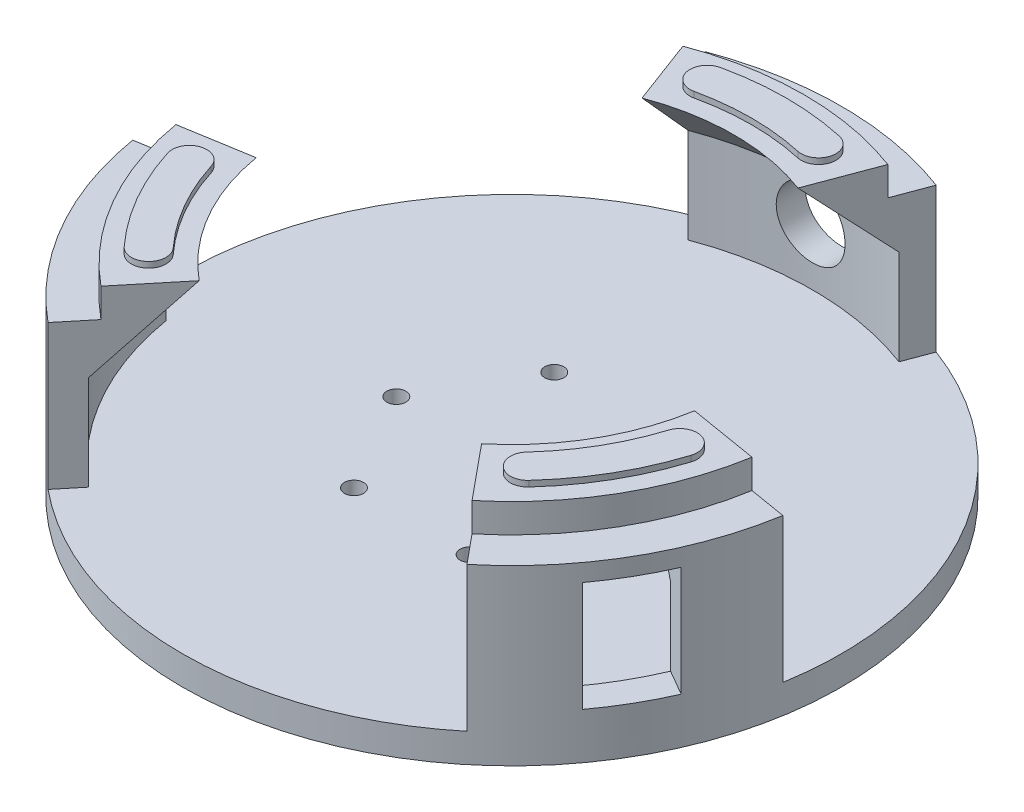
from build123d import *

# Parameters (mm, degrees)
CUT_EXTRUDE1_DEPTH           = 87.011627121
CIRPATTERN1_COUNT            = 3
BOSS_EXTRUDE1_DEPTH          = 1
CIRPATTERN2_COUNT            = 3
SKETCH4_R                    = 1.65
CUT_EXTRUDE2_DEPTH           = 87.365502372
CHAMFER1_SIZE                = 2.5
CIRPATTERN3_COUNT            = 6
CHAMFER1_OF_CIRPATTERN3_SIZE = 2.5
SKETCH5_R                    = 5.95
CUT_EXTRUDE3_DEPTH           = 84.300660261
SKETCH6_W                    = 12.5
SKETCH6_H                    = 19
CUT_EXTRUDE4_DEPTH           = 93.116895928


with BuildPart() as part:
    # Sketch1 → Revolve1 (revolve)
    with BuildSketch(Plane.XY):
        Polygon((50.5, 20), (50.5, 15), (57, 15), (57, -15), (0, -15), (0, -10), (52, -10), (52, 6.428932188), (38.428932188, 20), align=None)
    revolve(axis=Axis((0, 34.277777778, 0), (0, -1, 0)))

    # Sketch2 → Cut-Extrude1 (cut, through all)
    with BuildSketch(Plane(origin=(0, -10, 0), x_dir=(1, 0, 0), z_dir=(0, 1, 0))):
        with BuildLine():
            Line((20, 53.37602458), (12.98245614, 34.647594903))
            ThreePointArc((12.98245614, 34.647594903), (32.04293994, 18.5), (36.496925436, -6.08066063))
            Line((36.496925436, -6.08066063), (56.22499324, -9.367504214))
            ThreePointArc((56.22499324, -9.367504214), (49.363448016, 28.5), (20, 53.37602458))
        make_face()
    cut_extrude1 = extrude(amount=CUT_EXTRUDE1_DEPTH, mode=Mode.SUBTRACT)

    # CirPattern1: Cut-Extrude1 ×3 about axis
    cirpattern1_axis = Axis((0, 34.277777778, 0), (0, 1, 0))
    for i in range(1, CIRPATTERN1_COUNT):
        add(cut_extrude1.rotate(cirpattern1_axis, i * 360 / CIRPATTERN1_COUNT), mode=Mode.SUBTRACT)

    # Sketch3 → Boss-Extrude1 (add)
    with BuildSketch(Plane(origin=(0, 20, 0), x_dir=(1, 0, 0), z_dir=(0, 1, 0))):
        with BuildLine():
            ThreePointArc((10.273190717, 46.339368728), (0, 47.464466094), (-10.273190717, 46.339368728))
            ThreePointArc((-10.273190717, 46.339368728), (-12.552759897, 42.761161865), (-8.974553034, 40.481592685))
            ThreePointArc((-8.974553034, 40.481592685), (0, 41.464466094), (8.974553034, 40.481592685))
            ThreePointArc((8.974553034, 40.481592685), (12.552759897, 42.761161865), (10.273190717, 46.339368728))
        make_face()
    boss_extrude1 = extrude(amount=BOSS_EXTRUDE1_DEPTH)

    # CirPattern2: Boss-Extrude1 ×3 about axis
    cirpattern2_axis = Axis((0, 34.277777778, 0), (0, 1, 0))
    for i in range(1, CIRPATTERN2_COUNT):
        add(boss_extrude1.rotate(cirpattern2_axis, i * 360 / CIRPATTERN2_COUNT))

    # Sketch4 → Cut-Extrude2 (cut, through all)
    with BuildSketch(Plane(origin=(0, -10, 0), x_dir=(1, 0, 0), z_dir=(0, 1, 0))):
        with Locations((20, 0)):
            Circle(SKETCH4_R)
    cut_extrude2 = extrude(amount=-CUT_EXTRUDE2_DEPTH, mode=Mode.SUBTRACT)

    # Chamfer1
    chamfer1_edges = [part.edges().sort_by_distance(p)[0] for p in [
        (18.35, -15, 0),
    ]]
    chamfer(chamfer1_edges, length=CHAMFER1_SIZE)

    # CirPattern3: Cut-Extrude2 ×6 about axis
    cirpattern3_axis = Axis((0, 34.277777778, 0), (0, 1, 0))
    for i in range(1, CIRPATTERN3_COUNT):
        add(cut_extrude2.rotate(cirpattern3_axis, i * 360 / CIRPATTERN3_COUNT), mode=Mode.SUBTRACT)

    # Chamfer1 of CirPattern3
    chamfer1_of_cirpattern3_edges = [part.edges().sort_by_distance(p)[0] for p in [
        (9.175, -15, -15.891566159),
        (-9.175, -15, -15.891566159),
        (-18.35, -15, 0),
        (-9.175, -15, 15.891566159),
        (9.175, -15, 15.891566159),
    ]]
    chamfer(chamfer1_of_cirpattern3_edges, length=CHAMFER1_OF_CIRPATTERN3_SIZE)

    # Sketch5 → Cut-Extrude3 (cut, through all)
    with BuildSketch(Plane.XY):
        Circle(SKETCH5_R)
    extrude(amount=-CUT_EXTRUDE3_DEPTH, mode=Mode.SUBTRACT)

    # Sketch6 → Cut-Extrude4 (cut, through all)
    with BuildSketch(Plane(origin=(-8.11249662, 0, -4.683752107), x_dir=(-0.4999999999999981, 0, 0.8660254037844397), z_dir=(-0.8660254037844397, 0, -0.4999999999999981))):
        with Locations((0, 2.5)):
            Rectangle(SKETCH6_W, SKETCH6_H)
    extrude(amount=-CUT_EXTRUDE4_DEPTH, mode=Mode.SUBTRACT)


solid = part.part
